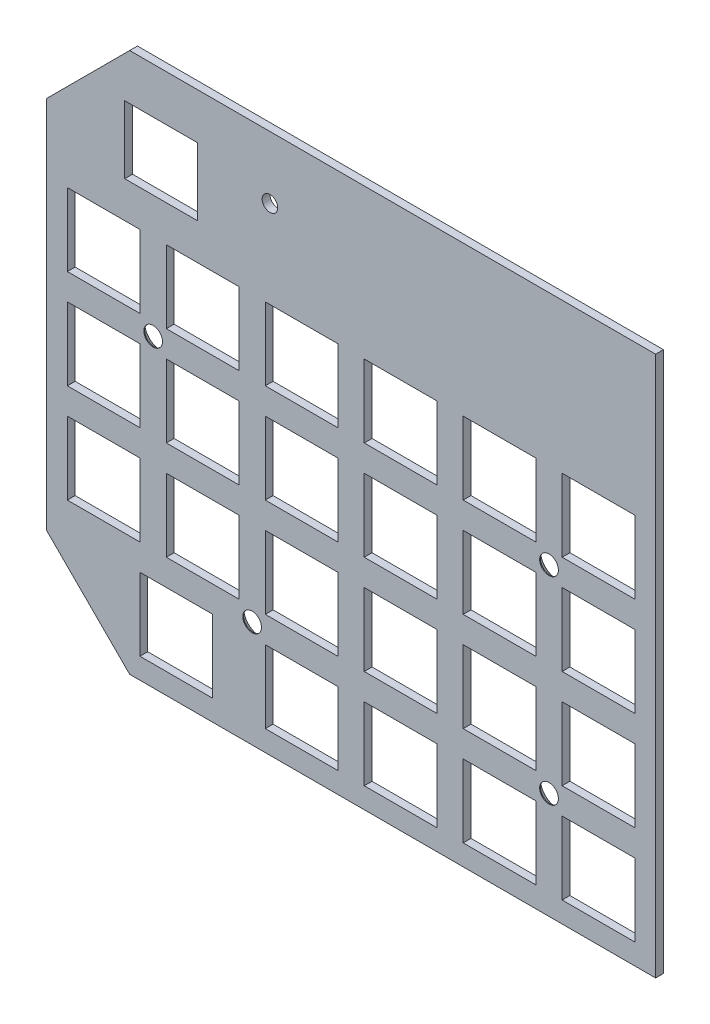
from build123d import *

# Parameters (mm, degrees)
BOSS_EXTRU_1_DEPTH                          = 1.5
ESQUISSE3_R                                 = 1.5
ESQUISSE3_W                                 = 14
ESQUISSE3_H                                 = 14
ESQUISSE3_H_2                               = 13
ENL_V_MAT_EXTRU_2_DEPTH                     = 10
FRAISAGE_POUR_VIS_T_TE_FRAIS_E_M31_AT_COUNT = 2
FRAISAGE_POUR_VIS_T_TE_FRAIS_E_M31_AT_PITCH = 38.1
FRAISAGE_POUR_VIS_T_TE_FRAIS_E_M31_2_COUNT  = 2
FRAISAGE_POUR_VIS_T_TE_FRAIS_E_M31_2_PITCH  = 76.2
FRAISAGE_POUR_VIS_T_TE_FRAIS_E_M31_3_COUNT  = 2
FRAISAGE_POUR_VIS_T_TE_FRAIS_E_M31_3_PITCH  = 68.685751798


with BuildPart() as part:
    # Esquisse1 → Boss.-Extru.1 (new body)
    with BuildSketch(Plane.XY):
        Polygon((0, -85), (16, -101), (117.25, -101), (117.25, 3), (16, 3), (0, -13), align=None)
    extrude(amount=BOSS_EXTRU_1_DEPTH)

    # Esquisse3 → Enlèv. mat.-Extru.2 (cut)
    with BuildSketch(Plane(origin=(0, 0, 0), x_dir=(-1, 0, 0), z_dir=(0, 0, -1))):
        with Locations((-43, -9)):
            Circle(ESQUISSE3_R)
        with Locations((-87.2, -32.85)):
            Rectangle(ESQUISSE3_W, ESQUISSE3_H)
        with Locations((-106.25, -32.85)):
            Rectangle(ESQUISSE3_W, ESQUISSE3_H)
        with Locations((-68.15, -32.85)):
            Rectangle(ESQUISSE3_W, ESQUISSE3_H)
        with Locations((-49.1, -32.85)):
            Rectangle(ESQUISSE3_W, ESQUISSE3_H)
        with Locations((-30.05, -32.85)):
            Rectangle(ESQUISSE3_W, ESQUISSE3_H)
        with Locations((-11, -32.85)):
            Rectangle(ESQUISSE3_W, ESQUISSE3_H)
        with Locations((-87.2, -51.9)):
            Rectangle(ESQUISSE3_W, ESQUISSE3_H)
        with Locations((-68.15, -51.9)):
            Rectangle(ESQUISSE3_W, ESQUISSE3_H)
        with Locations((-49.1, -51.9)):
            Rectangle(ESQUISSE3_W, ESQUISSE3_H)
        with Locations((-30.05, -51.9)):
            Rectangle(ESQUISSE3_W, ESQUISSE3_H)
        with Locations((-11, -51.9)):
            Rectangle(ESQUISSE3_W, ESQUISSE3_H)
        with Locations((-87.2, -70.95)):
            Rectangle(ESQUISSE3_W, ESQUISSE3_H)
        with Locations((-68.15, -70.95)):
            Rectangle(ESQUISSE3_W, ESQUISSE3_H)
        with Locations((-49.1, -70.95)):
            Rectangle(ESQUISSE3_W, ESQUISSE3_H)
        with Locations((-30.05, -70.95)):
            Rectangle(ESQUISSE3_W, ESQUISSE3_H)
        with Locations((-11, -70.95)):
            Rectangle(ESQUISSE3_W, ESQUISSE3_H)
        with Locations((-87.2, -90)):
            Rectangle(ESQUISSE3_W, ESQUISSE3_H)
        with Locations((-68.15, -90)):
            Rectangle(ESQUISSE3_W, ESQUISSE3_H)
        with Locations((-49.1, -90)):
            Rectangle(ESQUISSE3_W, ESQUISSE3_H)
        with Locations((-106.25, -51.9)):
            Rectangle(ESQUISSE3_W, ESQUISSE3_H)
        with Locations((-106.25, -70.95)):
            Rectangle(ESQUISSE3_W, ESQUISSE3_H)
        with Locations((-106.25, -90)):
            Rectangle(ESQUISSE3_W, ESQUISSE3_H)
        with Locations((-24.97, -90)):
            Rectangle(ESQUISSE3_W, ESQUISSE3_H)
        with Locations((-22.05, -12.35)):
            Rectangle(ESQUISSE3_W, ESQUISSE3_H_2)
    extrude(amount=-ENL_V_MAT_EXTRU_2_DEPTH, mode=Mode.SUBTRACT)

    # Esquisse6 → Fraisage pour vis à tête fraisée M31 (revolve, cut)
    with BuildSketch(Plane(origin=(96.725, -42.375, 0), x_dir=(0, 1, 0), z_dir=(1, 0, 0))):
        Polygon((0, 0), (0, 1.5), (1.8, 1.5), (1.8, 1.35), (3.15, 0), align=None)
    fraisage_pour_vis_t_te_frais_e_m31 = revolve(axis=Axis((96.725, -42.375, -6.35), (0, 0, 1)), mode=Mode.SUBTRACT)

    # Fraisage pour vis à tête fraisée M31 at: Fraisage pour vis à tête fraisée M31 ×2
    with Locations(*[(0, -i * FRAISAGE_POUR_VIS_T_TE_FRAIS_E_M31_AT_PITCH, 0) for i in range(1, FRAISAGE_POUR_VIS_T_TE_FRAIS_E_M31_AT_COUNT)]):
        add(fraisage_pour_vis_t_te_frais_e_m31, mode=Mode.SUBTRACT)

    # Fraisage pour vis _ t_te frais_e M31 2: Fraisage pour vis à tête fraisée M31 ×2
    with Locations(*[(-i * FRAISAGE_POUR_VIS_T_TE_FRAIS_E_M31_2_PITCH, 0, 0) for i in range(1, FRAISAGE_POUR_VIS_T_TE_FRAIS_E_M31_2_COUNT)]):
        add(fraisage_pour_vis_t_te_frais_e_m31, mode=Mode.SUBTRACT)

    # Fraisage pour vis _ t_te frais_e M31 3: Fraisage pour vis à tête fraisée M31 ×2
    with Locations(*[Vector(-0.8320502943378435, -0.5547001962252295, 0) * (i * FRAISAGE_POUR_VIS_T_TE_FRAIS_E_M31_3_PITCH) for i in range(1, FRAISAGE_POUR_VIS_T_TE_FRAIS_E_M31_3_COUNT)]):
        add(fraisage_pour_vis_t_te_frais_e_m31, mode=Mode.SUBTRACT)


solid = part.part
